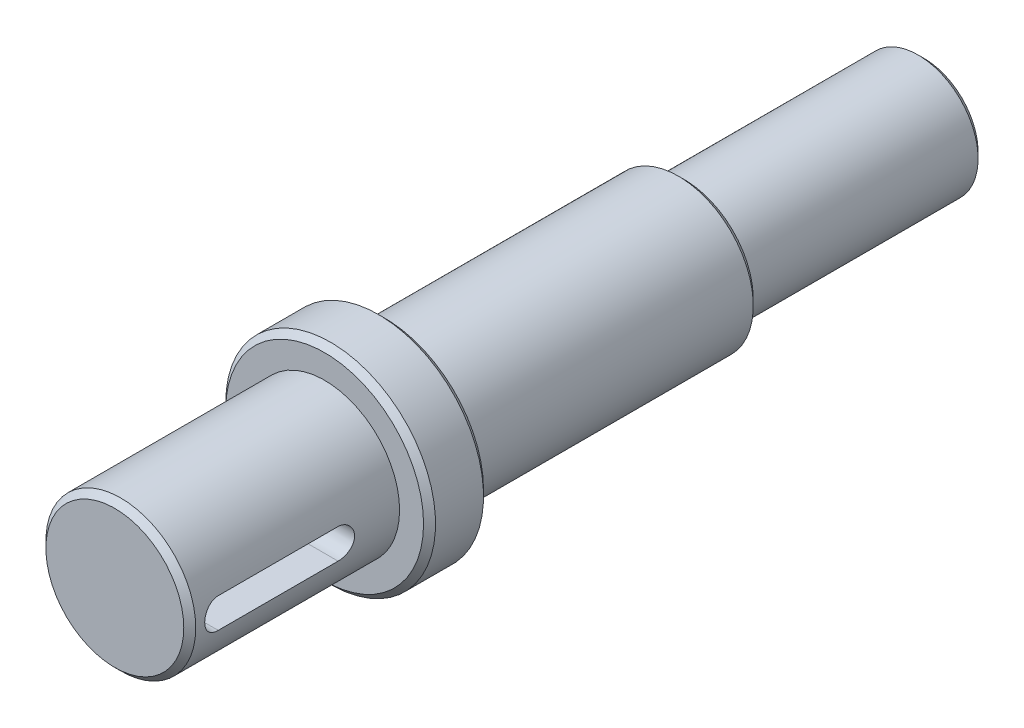
from build123d import *

# Parameters (mm, degrees)
SKETCH1_R             = 12.5
BOSS_EXTRUDE2_DEPTH   = 35
SKETCH6_R             = 17.5
BOSS_EXTRUDE3_DEPTH   = 10
BOSS_EXTRUDE4_START   = 50
SKETCH7_R             = 12.5
BOSS_EXTRUDE4_DEPTH   = 50
SKETCH8_R             = 10
BOSS_EXTRUDE5_DEPTH   = 40
CHAMFER1_SIZE         = 1
CUT_EXTRUDE11_START   = 5.24705599
CUT_EXTRUDE11_DEPTH   = 8.75294401
CUT_EXTRUDE11_START_2 = 6
CUT_EXTRUDE11_2_DEPTH = 28


with BuildPart() as part:
    # Sketch1 → Boss-Extrude2 (new body)
    with BuildSketch(Plane.XY):
        Circle(SKETCH1_R)
    extrude(amount=BOSS_EXTRUDE2_DEPTH)

    # Sketch6 → Boss-Extrude3 (add)
    with BuildSketch(Plane(origin=(0, 0, 0), x_dir=(-1, 0, 0), z_dir=(0, 0, -1))):
        Circle(SKETCH6_R)
    extrude(amount=BOSS_EXTRUDE3_DEPTH)

    # Sketch7 → Boss-Extrude4 (add)
    with BuildSketch(Plane(origin=(0, 0, -10), x_dir=(-1, 0, 0), z_dir=(0, 0, -1)).offset(BOSS_EXTRUDE4_START)):
        with Locations(Location((0, 0, 0), (0, 0, 180))):
            Circle(SKETCH7_R)
    extrude(amount=-BOSS_EXTRUDE4_DEPTH)

    # Sketch8 → Boss-Extrude5 (add)
    with BuildSketch(Plane(origin=(0, 0, -60), x_dir=(-1, 0, 0), z_dir=(0, 0, -1))):
        Circle(SKETCH8_R)
    extrude(amount=BOSS_EXTRUDE5_DEPTH)

    # Chamfer1
    chamfer1_edges = [part.edges().sort_by_distance(p)[0] for p in [
        (-12.5, 0, -60),
        (10, 0, -100),
        (-12.5, 0, 35),
        (17.5, 0, 0),
        (17.5, 0, -10),
    ]]
    chamfer(chamfer1_edges, length=CHAMFER1_SIZE)

    # Cut-Extrude11: read off the stored shape, not the designer's step
    # Cut-Extrude11 outline → Cut-Extrude11 (cut)
    with BuildSketch(Plane(origin=(0, 0, 0), x_dir=(0, 0, -1), z_dir=(1, 0, 0)).offset(CUT_EXTRUDE11_START)):
        with BuildLine():
            Line((-10, 2.501922686), (-30, 2.501922686))
            add(Edge.make_bspline(
                [(-30, 2.501922686), (-30.662861656, 2.501922686), (-31.308912406, 2.229348378), (-32.229370531, 1.308874674), (-32.501390649, 0.6564432), (-32.502453075, -0.652381374), (-32.23483126, -1.302936015), (-31.305267278, -2.233470473), (-30.662865998, -2.501922686), (-30, -2.501922686)],
                knots=[0, 0, 0, 0, 0.25, 0.25, 0.5, 0.5, 0.75, 0.75, 1, 1, 1, 1], degree=3))
            Line((-30, -2.501922686), (-10, -2.501922686))
            add(Edge.make_bspline(
                [(-10, -2.501922686), (-9.337138344, -2.501922686), (-8.691087594, -2.229348378), (-7.770629469, -1.308874674), (-7.498609351, -0.6564432), (-7.497546925, 0.652381374), (-7.76516874, 1.302936015), (-8.694732722, 2.233470473), (-9.337134002, 2.501922686), (-10, 2.501922686)],
                knots=[0, 0, 0, 0, 0.25, 0.25, 0.5, 0.5, 0.75, 0.75, 1, 1, 1, 1], degree=3))
        make_face()
    extrude(amount=CUT_EXTRUDE11_DEPTH, mode=Mode.SUBTRACT)

    # Cut-Extrude11 2 outline → Cut-Extrude11 2 (add)
    with BuildSketch(Plane.XY.offset(CUT_EXTRUDE11_START_2)):
        with BuildLine():
            ThreePointArc((5.24705609, -2.501922686), (5.5, 0), (5.24705609, 2.501922686))
            Line((5.24705609, 2.501922686), (5.24705609, -2.501922686))
        make_face()
    extrude(amount=CUT_EXTRUDE11_2_DEPTH)


solid = part.part
